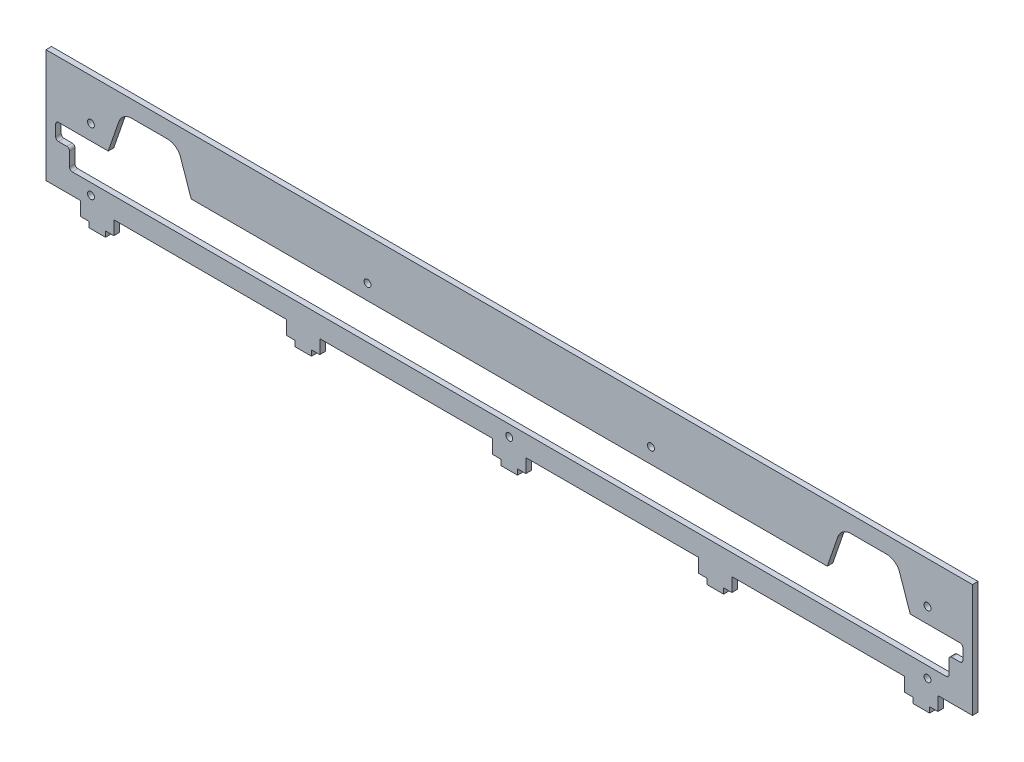
from build123d import *

# Parameters (mm, degrees)
SKETCH_1_W          = 670
SKETCH_1_H          = 92
EXTRUDE_1_DEPTH     = 2
SKETCH_2_W          = 125
SKETCH_2_H          = 10
CUT_EXTRUDE_1_DEPTH = 339.167118449
CUT_EXTRUDE_2_DEPTH = 339.167118449
FILLET_1_R          = 10
FILLET_6_R          = 2
SKETCH_4_R          = 2.5
CUT_EXTRUDE_3_DEPTH = 339.167118449
SKETCH_6_W          = 12
SKETCH_6_H          = 4
EXTRUDE_2_DEPTH     = 4


with BuildPart() as part:
    # Эскиз1 → Бобышка-Вытянуть1 (new, symmetric)
    with BuildSketch(Plane.XY):
        Rectangle(SKETCH_1_W, SKETCH_1_H)
    extrude(amount=EXTRUDE_1_DEPTH, both=True)

    # Эскиз2 → Вырез-Вытянуть1 (cut, through all)
    with BuildSketch(Plane.XY.offset(2)):
        with Locations((-372.5, -41)):
            Rectangle(SKETCH_2_W, SKETCH_2_H)
        with Locations((-223.5, -41)):
            Rectangle(SKETCH_2_W, SKETCH_2_H)
        with Locations((-74.5, -41)):
            Rectangle(SKETCH_2_W, SKETCH_2_H)
        with Locations((74.5, -41)):
            Rectangle(SKETCH_2_W, SKETCH_2_H)
        with Locations((223.5, -41)):
            Rectangle(SKETCH_2_W, SKETCH_2_H)
        with Locations((372.5, -41)):
            Rectangle(SKETCH_2_W, SKETCH_2_H)
    extrude(amount=-CUT_EXTRUDE_1_DEPTH, mode=Mode.SUBTRACT)

    # Эскиз3 → Вырез-Вытянуть2 (cut, through all)
    with BuildSketch(Plane.XY.offset(2)):
        Polygon((-328, 5), (-328, -7), (-318, -7), (-318, -21), (318, -21), (318, -7), (328, -7), (328, 5), (290, 5), (280, 34), (240, 34), (230, 5), (-230, 5), (-240, 34), (-280, 34), (-290, 5), align=None)
    extrude(amount=-CUT_EXTRUDE_2_DEPTH, mode=Mode.SUBTRACT)

    # Скругление1
    fillet_1_edges = [part.edges().sort_by_distance(p)[0] for p in [
        (240, 34, 0),
        (280, 34, 0),
        (-240, 34, 0),
        (-280, 34, 0),
    ]]
    fillet(fillet_1_edges, radius=FILLET_1_R)

    # Скругление6
    fillet_6_edges = [part.edges().sort_by_distance(p)[0] for p in [
        (328, -7, 0),
        (318, -7, 0),
        (318, -21, 0),
        (-318, -21, 0),
        (-318, -7, 0),
        (-328, -7, 0),
        (328, 5, 0),
        (-328, 5, 0),
    ]]
    fillet(fillet_6_edges, radius=FILLET_6_R)

    # Эскиз4 → Вырез-Вытянуть3 (cut, through all)
    with BuildSketch(Plane.XY.offset(2)):
        with Locations((-302.5, -29)):
            Circle(SKETCH_4_R)
        with Locations((0, -29)):
            Circle(SKETCH_4_R)
        with Locations((302.5, -29)):
            Circle(SKETCH_4_R)
        with Locations((-102.5, 16)):
            Circle(SKETCH_4_R)
        with Locations((102.5, 16)):
            Circle(SKETCH_4_R)
        with Locations((-302.5, 16)):
            Circle(SKETCH_4_R)
        with Locations((302.5, 16)):
            Circle(SKETCH_4_R)
    extrude(amount=-CUT_EXTRUDE_3_DEPTH, mode=Mode.SUBTRACT)

    # Эскиз6 → Бобышка-Вытянуть2 (add)
    with BuildSketch(Plane.XZ.offset(46)):
        with Locations((298, 0)):
            Rectangle(SKETCH_6_W, SKETCH_6_H)
        with Locations((149, 0)):
            Rectangle(SKETCH_6_W, SKETCH_6_H)
        Rectangle(SKETCH_6_W, SKETCH_6_H)
        with Locations((-149, 0)):
            Rectangle(SKETCH_6_W, SKETCH_6_H)
        with Locations((-298, 0)):
            Rectangle(SKETCH_6_W, SKETCH_6_H)
    extrude(amount=EXTRUDE_2_DEPTH)


solid = part.part
